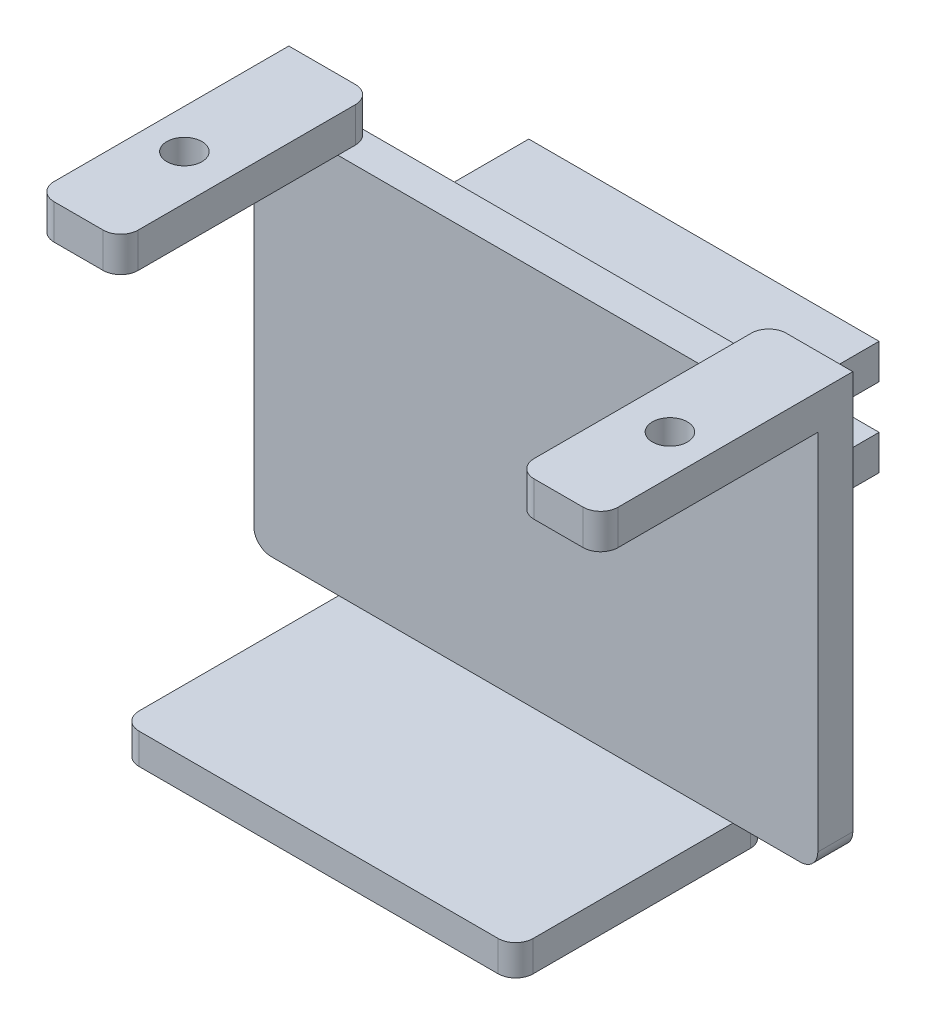
from build123d import *

# Parameters (mm, degrees)
SKETCH1_W           = 32.2
SKETCH1_H           = 25.5
BOSS_EXTRUDE1_DEPTH = 14.4
SKETCH3_W           = 32.2
SKETCH3_H           = 21.75
CUT_EXTRUDE1_DEPTH  = 12.4
SKETCH5_W           = 22.6
SKETCH5_H           = 2
CUT_EXTRUDE2_DEPTH  = 14.4
FILLET1_R           = 1
FILLET2_R           = 1
FILLET3_R           = 1
FILLET4_R           = 1
SKETCH10_R          = 1
CUT_EXTRUDE3_DEPTH  = 10
SKETCH11_W          = 4.85
SKETCH11_H          = 1.75
CUT_EXTRUDE4_DEPTH  = 20
FILLET5_R           = 1
FILLET6_R           = 1
SKETCH12_W          = 20
SKETCH12_H          = 2
BOSS_EXTRUDE2_DEPTH = 5
SKETCH13_W          = 20
SKETCH13_H          = 2
BOSS_EXTRUDE3_DEPTH = 5


with BuildPart() as part:
    # Sketch1 → Boss-Extrude1 (new body)
    with BuildSketch(Plane.XY):
        Rectangle(SKETCH1_W, SKETCH1_H)
    extrude(amount=BOSS_EXTRUDE1_DEPTH)

    # Sketch3 → Cut-Extrude1 (cut)
    with BuildSketch(Plane.XY.offset(14.4)):
        with Locations((0, -0.125)):
            Rectangle(SKETCH3_W, SKETCH3_H)
    extrude(amount=-CUT_EXTRUDE1_DEPTH, mode=Mode.SUBTRACT)

    # Sketch5 → Cut-Extrude2 (cut)
    with BuildSketch(Plane.XY.offset(14.4)):
        with Locations((0, 11.75)):
            Rectangle(SKETCH5_W, SKETCH5_H)
    extrude(amount=-CUT_EXTRUDE2_DEPTH, mode=Mode.SUBTRACT)

    # Fillet1
    fillet1_edges = [part.edges().sort_by_distance(p)[0] for p in [
        (-11.3, 11.75, 14.4),
    ]]
    fillet(fillet1_edges, radius=FILLET1_R)

    # Fillet2
    fillet2_edges = [part.edges().sort_by_distance(p)[0] for p in [
        (-16.1, 11.75, 14.4),
    ]]
    fillet(fillet2_edges, radius=FILLET2_R)

    # Fillet3
    fillet3_edges = [part.edges().sort_by_distance(p)[0] for p in [
        (11.3, 11.75, 14.4),
    ]]
    fillet(fillet3_edges, radius=FILLET3_R)

    # Fillet4
    fillet4_edges = [part.edges().sort_by_distance(p)[0] for p in [
        (16.1, 11.75, 14.4),
    ]]
    fillet(fillet4_edges, radius=FILLET4_R)

    # Sketch10 → Cut-Extrude3 (cut)
    with BuildSketch(Plane(origin=(0, 12.75, 0), x_dir=(1, 0, 0), z_dir=(0, 1, 0))):
        with Locations((-13.86, -8.203047487)):
            Circle(SKETCH10_R)
    cut_extrude3 = extrude(amount=-CUT_EXTRUDE3_DEPTH, mode=Mode.SUBTRACT)

    # Mirror1: Cut-Extrude3 across plane
    add(cut_extrude3.mirror(Plane(origin=(0, 0, 0), x_dir=(0, 0, 1), z_dir=(1, 0, 0))), mode=Mode.SUBTRACT)

    # Sketch11 → Cut-Extrude4 (cut)
    with BuildSketch(Plane.XY.offset(14.4)):
        with Locations((-13.675, -11.875)):
            Rectangle(SKETCH11_W, SKETCH11_H)
    cut_extrude4 = extrude(amount=-CUT_EXTRUDE4_DEPTH, mode=Mode.SUBTRACT)

    # Mirror2: Cut-Extrude4 across plane
    add(cut_extrude4.mirror(Plane(origin=(0, 0, 0), x_dir=(0, 0, 1), z_dir=(1, 0, 0))), mode=Mode.SUBTRACT)

    # Fillet5
    fillet5_edges = [part.edges().sort_by_distance(p)[0] for p in [
        (-11.25, -11.875, 0),
        (-16.1, -11, 1),
        (16.1, -11, 1),
        (11.25, -11.875, 0),
        (11.25, -11.875, 14.4),
        (-11.25, -11.875, 14.4),
    ]]
    fillet(fillet5_edges, radius=FILLET5_R)

    # Fillet6
    fillet6_edges = [part.edges().sort_by_distance(p)[0] for p in [
        (-11.3, 11.75, 0),
        (11.3, 11.75, 0),
    ]]
    fillet(fillet6_edges, radius=FILLET6_R)

    # Sketch12 → Boss-Extrude2 (add)
    with BuildSketch(Plane(origin=(0, 0, 0), x_dir=(-1, 0, 0), z_dir=(0, 0, -1))):
        with Locations((-2.6, 4.5)):
            Rectangle(SKETCH12_W, SKETCH12_H)
    extrude(amount=BOSS_EXTRUDE2_DEPTH)

    # Sketch13 → Boss-Extrude3 (add)
    with BuildSketch(Plane(origin=(0, 0, 0), x_dir=(-1, 0, 0), z_dir=(0, 0, -1))):
        with Locations((-2.6, 9)):
            Rectangle(SKETCH13_W, SKETCH13_H)
    extrude(amount=BOSS_EXTRUDE3_DEPTH)


solid = part.part
